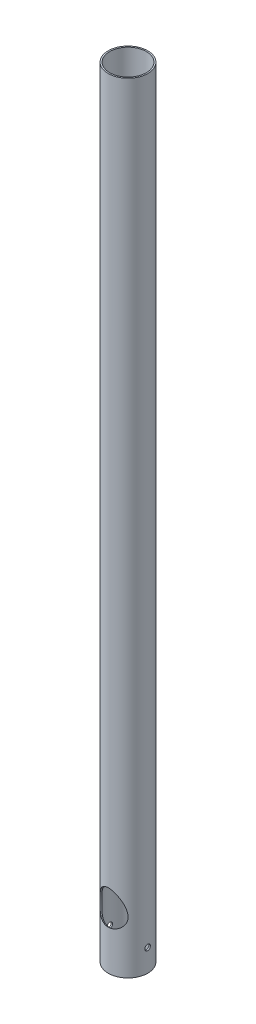
from build123d import *

# Parameters (mm, degrees)
EXTRUDE_1_OUTLINE_R      = 70.5
EXTRUDE_1_OUTLINE_R_2    = 65.5
EXTRUDE_1_DEPTH          = 2780
CUT_EXTRUDE_3_DEPTH      = 2782.787285182
CUT_EXTRUDE_3_DEPTH_BACK = 2782.787285182
SKETCH_6_R               = 10
SKETCH_7_R               = 50
CUT_EXTRUDE_4_DEPTH      = 200
SKETCH_10_R              = 55
CUT_EXTRUDE_5_DEPTH      = 2782.787285287
SKETCH_13_R              = 52.5
CUT_EXTRUDE_8_DEPTH      = 200


# Read off the part's stored shape, not the designer's step: Вытянуть-Тонкостенный1
with BuildPart() as part:
    # Вытянуть-Тонкостенный1 outline → Вытянуть-Тонкостенный1 (new body)
    with BuildSketch(Plane(origin=(0, 0, 0), x_dir=(1, 0, 0), z_dir=(0, 1, 0))):
        Circle(EXTRUDE_1_OUTLINE_R)
        Circle(EXTRUDE_1_OUTLINE_R_2, mode=Mode.SUBTRACT)
    extrude(amount=EXTRUDE_1_DEPTH)

    # Эскиз6 → Вырез-Вытянуть3 (cut, two sides: drawn at the far end of the back side and taken through both)
    with BuildSketch(Plane(origin=(0, 0, 0), x_dir=(0, 0, -1), z_dir=(1, 0, 0)).offset(-CUT_EXTRUDE_3_DEPTH_BACK)):
        with Locations((0, 80)):
            Circle(SKETCH_6_R)
    extrude(amount=CUT_EXTRUDE_3_DEPTH + CUT_EXTRUDE_3_DEPTH_BACK, mode=Mode.SUBTRACT)

    # Эскиз7 → Вырез-Вытянуть4 (cut)
    with BuildSketch(Plane(origin=(0, 176.689515805, 252.338779809), x_dir=(1, 0, 0), z_dir=(0, -0.5735764363510416, -0.8191520442889949))):
        with Locations(Location((0, -126.118813858, 0), (0, 0, 90))):
            Circle(SKETCH_7_R)
    extrude(amount=CUT_EXTRUDE_4_DEPTH, mode=Mode.SUBTRACT)

    # Эскиз10 → Вырез-Вытянуть5 (cut, through all)
    with BuildSketch(Plane.XY):
        with Locations(Location((0, 2630, 0), (0, 0, 90))):
            Circle(SKETCH_10_R)
    extrude(amount=-CUT_EXTRUDE_5_DEPTH, mode=Mode.SUBTRACT)

    # Эскиз13 → Вырез-Вытянуть8 (cut)
    with BuildSketch(Plane(origin=(0, 751.957243663, 1073.906238692), x_dir=(1, 0, 0), z_dir=(0, -0.5735764363510416, -0.8191520442889949))):
        with Locations((0, -2186.118813857)):
            Circle(SKETCH_13_R)
    extrude(amount=-CUT_EXTRUDE_8_DEPTH, mode=Mode.SUBTRACT)


solid = part.part
